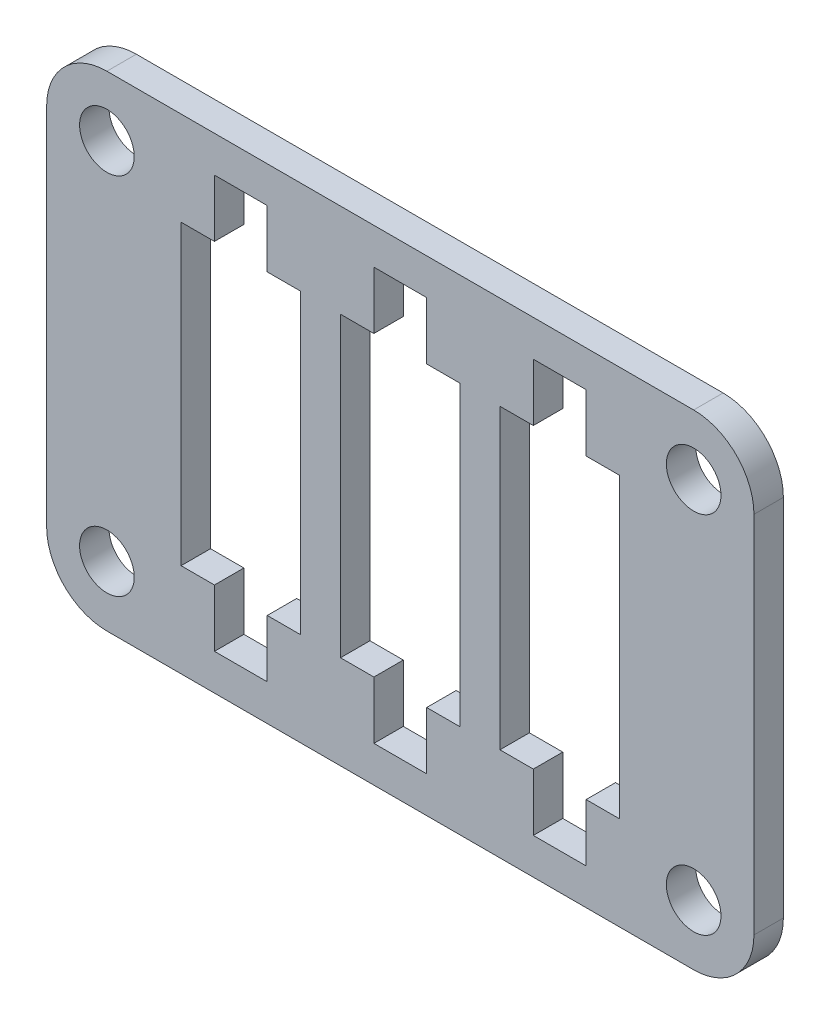
from build123d import *

# Parameters (mm, degrees)
SKETCH2_W              = 38
SKETCH2_H              = 26
BOSS_EXTRUDE1_DEPTH    = 1.5875
CUT_EXTRUDE1_DEPTH     = 47.070816753
FILLET1_R              = 3.175
SKETCH6_R              = 1.55
CUT_EXTRUDE2_DEPTH     = 47.070816753
MOVE_FACE1_OUTLINE_R   = 1.55
MOVE_FACE1_OUTLINE_R_2 = 1.4738
MOVE_FACE1_DEPTH       = 1.5875


# Read off the part's stored shape, not the designer's step: Move Face1
with BuildPart() as part:
    # Sketch2 → Boss-Extrude1 (new body)
    with BuildSketch(Plane.XY):
        with Locations((19, 13)):
            Rectangle(SKETCH2_W, SKETCH2_H)
    extrude(amount=BOSS_EXTRUDE1_DEPTH)

    # Sketch3 → Cut-Extrude1 (cut, through all)
    with BuildSketch(Plane.XY.offset(1.5875)):
        Polygon((7.1, 21.1), (8.9, 21.1), (8.9, 24.2), (11.9, 24.2), (11.9, 21.1), (13.7, 21.1), (13.7, 4.9), (11.9, 4.9), (11.9, 1.8), (8.9, 1.8), (8.9, 4.9), (7.1, 4.9), align=None)
        Polygon((15.7, 21.1), (17.5, 21.1), (17.5, 24.2), (20.5, 24.2), (20.5, 21.1), (22.3, 21.1), (22.3, 4.9), (20.5, 4.9), (20.5, 1.8), (17.5, 1.8), (17.5, 4.9), (15.7, 4.9), align=None)
        Polygon((24.3, 21.1), (26.1, 21.1), (26.1, 24.2), (29.1, 24.2), (29.1, 21.1), (30.9, 21.1), (30.9, 4.9), (29.1, 4.9), (29.1, 1.8), (26.1, 1.8), (26.1, 4.9), (24.3, 4.9), align=None)
    extrude(amount=-CUT_EXTRUDE1_DEPTH, mode=Mode.SUBTRACT)

    # Fillet1
    fillet1_edges = [part.edges().sort_by_distance(p)[0] for p in [
        (0, 26, 0.79375),
        (38, 26, 0.79375),
        (38, 0, 0.79375),
        (0, 0, 0.79375),
    ]]
    fillet(fillet1_edges, radius=FILLET1_R)

    # Sketch6 → Cut-Extrude2 (cut, through all)
    with BuildSketch(Plane.XY.offset(1.5875)):
        with Locations((3.175, 22.825)):
            Circle(SKETCH6_R)
        with Locations((34.825, 22.825)):
            Circle(SKETCH6_R)
        with Locations((34.825, 3.175)):
            Circle(SKETCH6_R)
        with Locations((3.175, 3.175)):
            Circle(SKETCH6_R)
    extrude(amount=-CUT_EXTRUDE2_DEPTH, mode=Mode.SUBTRACT)

    # Move Face1 outline → Move Face1 (add)
    # profile 1 of 8: a face of its own
    with BuildSketch(Plane.XY):
        with BuildLine():
            Line((-0.0762, 22.825), (-0.0762, 3.175))
            ThreePointArc((-0.0762, 3.175), (0.876054433, 0.876054433), (3.175, -0.0762))
            Line((3.175, -0.0762), (34.825, -0.0762))
            ThreePointArc((34.825, -0.0762), (37.123945567, 0.876054433), (38.0762, 3.175))
            Line((38.0762, 3.175), (38.0762, 22.825))
            ThreePointArc((38.0762, 22.825), (37.123945567, 25.123945567), (34.825, 26.0762))
            Line((34.825, 26.0762), (3.175, 26.0762))
            ThreePointArc((3.175, 26.0762), (0.876054433, 25.123945567), (-0.0762, 22.825))
        make_face()
        with BuildLine():
            ThreePointArc((3.175, 0), (0.92993597, 0.92993597), (0, 3.175))
            Line((0, 3.175), (0, 22.825))
            ThreePointArc((0, 22.825), (0.92993597, 25.07006403), (3.175, 26))
            Line((3.175, 26), (34.825, 26))
            ThreePointArc((34.825, 26), (37.07006403, 25.07006403), (38, 22.825))
            Line((38, 22.825), (38, 3.175))
            ThreePointArc((38, 3.175), (37.07006403, 0.92993597), (34.825, 0))
            Line((34.825, 0), (3.175, 0))
        make_face(mode=Mode.SUBTRACT)
    # profile 2 of 8: a face of its own
    with BuildSketch(Plane.XY):
        Polygon((26.1, 21.1), (24.3, 21.1), (24.3, 4.9), (26.1, 4.9), (26.1, 1.8), (29.1, 1.8), (29.1, 4.9), (30.9, 4.9), (30.9, 21.1), (29.1, 21.1), (29.1, 24.2), (26.1, 24.2), align=None)
        Polygon((24.3762, 4.9762), (24.3762, 21.0238), (26.1762, 21.0238), (26.1762, 24.1238), (29.0238, 24.1238), (29.0238, 21.0238), (30.8238, 21.0238), (30.8238, 4.9762), (29.0238, 4.9762), (29.0238, 1.8762), (26.1762, 1.8762), (26.1762, 4.9762), align=None, mode=Mode.SUBTRACT)
    # profile 3 of 8: a face of its own
    with BuildSketch(Plane.XY):
        Polygon((17.5, 24.2), (17.5, 21.1), (15.7, 21.1), (15.7, 4.9), (17.5, 4.9), (17.5, 1.8), (20.5, 1.8), (20.5, 4.9), (22.3, 4.9), (22.3, 21.1), (20.5, 21.1), (20.5, 24.2), align=None)
        Polygon((15.7762, 21.0238), (17.5762, 21.0238), (17.5762, 24.1238), (20.4238, 24.1238), (20.4238, 21.0238), (22.2238, 21.0238), (22.2238, 4.9762), (20.4238, 4.9762), (20.4238, 1.8762), (17.5762, 1.8762), (17.5762, 4.9762), (15.7762, 4.9762), align=None, mode=Mode.SUBTRACT)
    # profile 4 of 8: a face of its own
    with BuildSketch(Plane.XY):
        Polygon((8.9, 24.2), (8.9, 21.1), (7.1, 21.1), (7.1, 4.9), (8.9, 4.9), (8.9, 1.8), (11.9, 1.8), (11.9, 4.9), (13.7, 4.9), (13.7, 21.1), (11.9, 21.1), (11.9, 24.2), align=None)
        Polygon((7.1762, 21.0238), (8.9762, 21.0238), (8.9762, 24.1238), (11.8238, 24.1238), (11.8238, 21.0238), (13.6238, 21.0238), (13.6238, 4.9762), (11.8238, 4.9762), (11.8238, 1.8762), (8.9762, 1.8762), (8.9762, 4.9762), (7.1762, 4.9762), align=None, mode=Mode.SUBTRACT)
    # profile 5 of 8: a face of its own
    with BuildSketch(Plane.XY):
        with Locations((3.175, 22.825)):
            Circle(MOVE_FACE1_OUTLINE_R)
        with Locations((3.175, 22.825)):
            Circle(MOVE_FACE1_OUTLINE_R_2, mode=Mode.SUBTRACT)
    # profile 6 of 8: a face of its own
    with BuildSketch(Plane.XY):
        with Locations((34.825, 22.825)):
            Circle(MOVE_FACE1_OUTLINE_R)
        with Locations((34.825, 22.825)):
            Circle(MOVE_FACE1_OUTLINE_R_2, mode=Mode.SUBTRACT)
    # profile 7 of 8: a face of its own
    with BuildSketch(Plane.XY):
        with Locations((34.825, 3.175)):
            Circle(MOVE_FACE1_OUTLINE_R)
        with Locations((34.825, 3.175)):
            Circle(MOVE_FACE1_OUTLINE_R_2, mode=Mode.SUBTRACT)
    # profile 8 of 8: a face of its own
    with BuildSketch(Plane.XY):
        with Locations((3.175, 3.175)):
            Circle(MOVE_FACE1_OUTLINE_R)
        with Locations((3.175, 3.175)):
            Circle(MOVE_FACE1_OUTLINE_R_2, mode=Mode.SUBTRACT)
    extrude(amount=MOVE_FACE1_DEPTH)


solid = part.part
